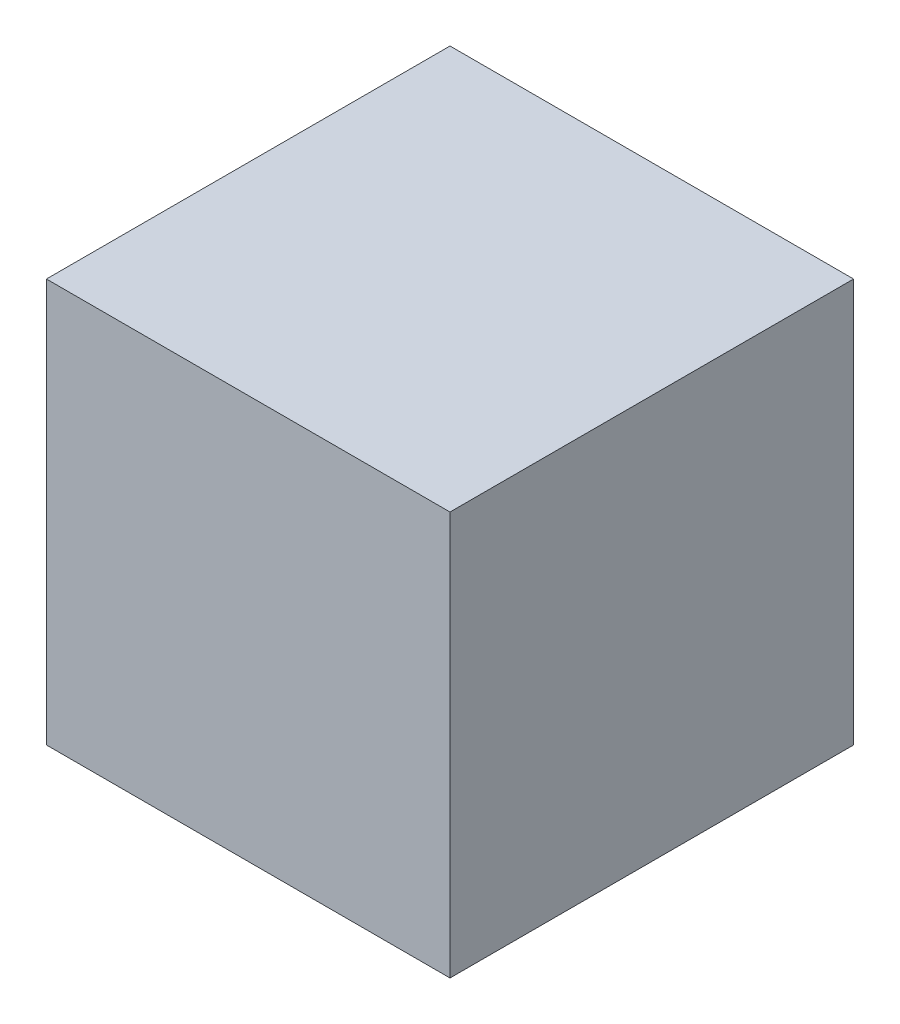
from build123d import *

# Parameters (mm, degrees)
ESQUISSE1_W        = 8
ESQUISSE1_H        = 8
BOSS_EXTRU_1_DEPTH = 4


with BuildPart() as part:
    # Esquisse1 → Boss.-Extru.1 (new, symmetric)
    with BuildSketch(Plane(origin=(0, 0, 0), x_dir=(0, 0, -1), z_dir=(1, 0, 0))):
        Rectangle(ESQUISSE1_W, ESQUISSE1_H)
    extrude(amount=BOSS_EXTRU_1_DEPTH, both=True)


solid = part.part
